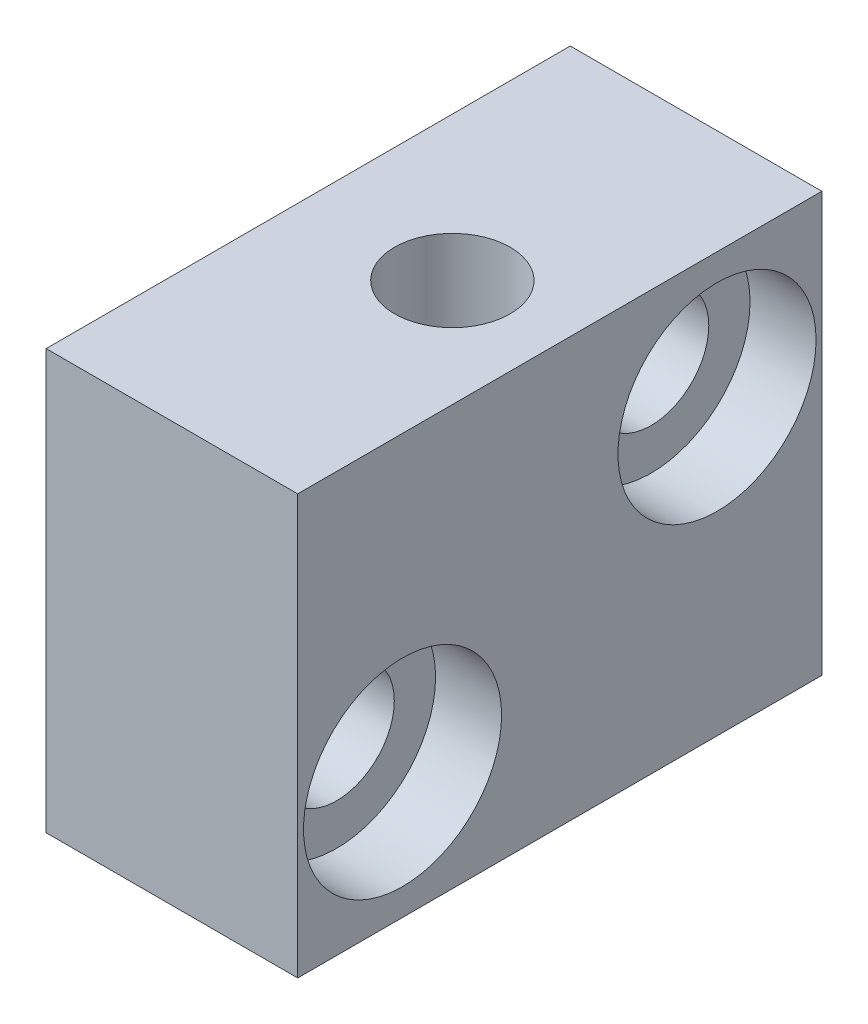
from build123d import *

# Parameters (mm, degrees)
SKETCH1_W           = 12.7
SKETCH1_H           = 15.875
BOSS_EXTRUDE1_DEPTH = 7.62
SKETCH3_R           = 1.75
CUT_EXTRUDE1_DEPTH  = 22.2885
SKETCH4_R           = 1.75
CUT_EXTRUDE2_DEPTH  = 22.2885
SKETCH5_R           = 3
CUT_EXTRUDE3_DEPTH  = 2


with BuildPart() as part:
    # Sketch1 → Boss-Extrude1 (new body)
    with BuildSketch(Plane.YZ):
        Rectangle(SKETCH1_W, SKETCH1_H)
    extrude(amount=BOSS_EXTRUDE1_DEPTH)

    # Sketch3 → Cut-Extrude1 (cut)
    with BuildSketch(Plane.XZ.offset(6.35)):
        with Locations((4.36625, 0)):
            Circle(SKETCH3_R)
    extrude(amount=-CUT_EXTRUDE1_DEPTH, mode=Mode.SUBTRACT)

    # Sketch4 → Cut-Extrude2 (cut)
    with BuildSketch(Plane.YZ.offset(7.62)):
        with Locations((-2.54, 4.7625)):
            Circle(SKETCH4_R)
        with Locations((2.54, -4.7625)):
            Circle(SKETCH4_R)
    extrude(amount=-CUT_EXTRUDE2_DEPTH, mode=Mode.SUBTRACT)

    # Sketch5 → Cut-Extrude3 (cut)
    with BuildSketch(Plane.YZ.offset(7.62)):
        with Locations((-2.54, 4.7625)):
            Circle(SKETCH5_R)
        with Locations((2.54, -4.7625)):
            Circle(SKETCH5_R)
    extrude(amount=-CUT_EXTRUDE3_DEPTH, mode=Mode.SUBTRACT)


solid = part.part
